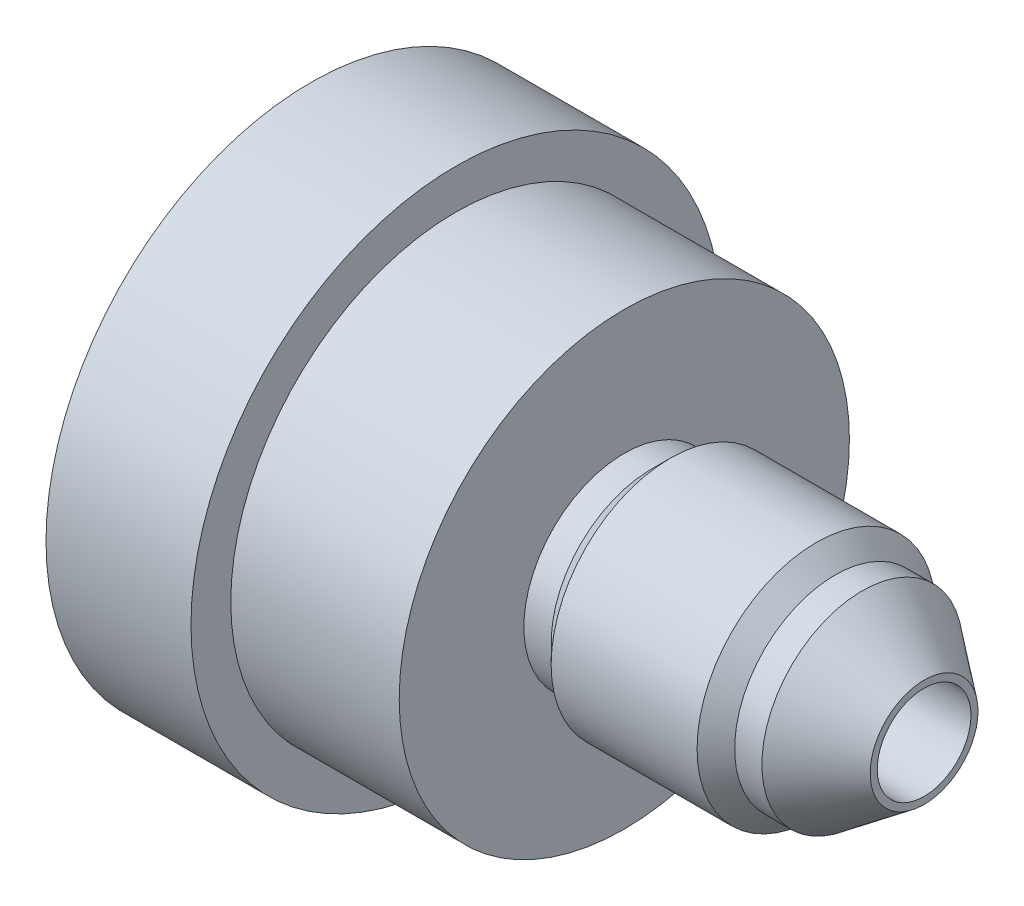
from build123d import *

# Parameters (mm, degrees)
CUT_SWEEP1_PITCH = 1.27


with BuildPart() as part:
    # Sketch1 → Revolve1 (revolve)
    with BuildSketch(Plane.XY, mode=Mode.PRIVATE) as revolve1_sk:
        Polygon((-14.2875, 12.3444), (-14.2875, 11.176), (-2.355243782, 2.1844), (14.2875, 2.1844), (14.2875, 2.51206), (14.2875, 5.55625), (10.247723424, 5.55625), (0.3175, 5.55625), (0.3175, 10.4902), (-7.5311, 10.4902), (-7.5311, 12.3444), align=None)
    revolve(revolve1_sk.sketch.rotate(Axis((-14.2875, 0, 0), (1, 0, 0)), 90), axis=Axis((-14.2875, 0, 0), (1, 0, 0)))

    # Cut-Sweep1: the profile of Sketch4 profile screwed along a right-hand helix of 11 turns, 8 arcs to a turn; built about Z, then put on its axis
    cut_sweep1_z = Axis((0, 0, 0), (0, 0, 1))
    cut_sweep1_corners = [(5.55655, 0, 0.000173205), (5.55655, 0, -1.111423205), (4.731360803, 0, -0.635), (4.731360803, 0, -0.47625)]
    with BuildLine(mode=Mode.PRIVATE) as cut_sweep1_profile:
        Line(cut_sweep1_corners[0], cut_sweep1_corners[1])
        Line(cut_sweep1_corners[1], cut_sweep1_corners[2])
        Line(cut_sweep1_corners[2], cut_sweep1_corners[3])
        Line(cut_sweep1_corners[3], cut_sweep1_corners[0])
    cut_sweep1_cap = Face(cut_sweep1_profile.wire())
    cut_sweep1_turn_angles = [0, 22.5, 45, 67.5, 90, 112.5, 135, 157.5, 180, 202.5, 225, 247.5, 270, 292.5, 315, 337.5, 360]
    cut_sweep1_turn_weights = [1, 0.9238795325112867, 1, 0.9238795325112867, 1, 0.9238795325112867, 1, 0.9238795325112867, 1, 0.9238795325112867, 1, 0.9238795325112867, 1, 0.9238795325112867, 1, 0.9238795325112867, 1]
    cut_sweep1_turn_rails = [Edge.make_bspline([Vector(p[0], p[1], 0).rotate(cut_sweep1_z, cut_sweep1_turn_angles[k]) / cut_sweep1_turn_weights[k] + Vector(0, 0, p[2] + CUT_SWEEP1_PITCH * cut_sweep1_turn_angles[k] / 360) for k in range(17)], [0, 0, 0, 1, 1, 2, 2, 3, 3, 4, 4, 5, 5, 6, 6, 7, 7, 8, 8, 8], 2, cut_sweep1_turn_weights) for p in cut_sweep1_corners]
    cut_sweep1_turn_sides = [Face.make_surface_from_curves(cut_sweep1_turn_rails[p[0]], cut_sweep1_turn_rails[p[1]]) for p in [(0, 1), (1, 2), (2, 3), (3, 0)]]
    cut_sweep1_turn = Solid(Shell([*cut_sweep1_turn_sides, cut_sweep1_cap, cut_sweep1_cap.rotate(cut_sweep1_z, 360).moved(Location((0, 0, CUT_SWEEP1_PITCH * 360 / 360)))]))
    cut_sweep1_each = [*[cut_sweep1_turn.moved(Location((0, 0, CUT_SWEEP1_PITCH * i))) for i in range(11)]]
    add(Plane(origin=(14.2875, 0, 0), x_dir=(0, 1, 0), z_dir=(-1, 0, 0)) * Compound([cut_sweep1_each[i] for i in range(0, 11, 2)]), mode=Mode.SUBTRACT)
    add(Plane(origin=(14.2875, 0, 0), x_dir=(0, 1, 0), z_dir=(-1, 0, 0)) * Compound([cut_sweep1_each[i] for i in range(1, 11, 2)]), mode=Mode.SUBTRACT)

    # Sketch5 → Cut-Revolve1 (revolve, cut)
    with BuildSketch(Plane.XY, mode=Mode.PRIVATE) as cut_revolve1_sk:
        Polygon((14.2875, 2.51206), (11.409802239, 4.680560803), (10.139802239, 4.680560803), (9.264113042, 5.55625), (14.2875, 5.55625), align=None)
        Polygon((0.3175, 5.55625), (0.3175, 4.680560803), (1.5875, 4.680560803), (2.463189197, 5.55625), align=None)
    revolve(cut_revolve1_sk.sketch.rotate(Axis((0, 0, 0), (-1, 0, 0)), 90), axis=Axis((0, 0, 0), (-1, 0, 0)), mode=Mode.SUBTRACT)

    # Sketch6 → Revolve2 (revolve)
    with BuildSketch(Plane.XY, mode=Mode.PRIVATE) as revolve2_sk:
        Polygon((2.463189197, 5.55625), (1.5875, 4.680560803), (10.139802239, 4.680560803), (9.264113042, 5.55625), align=None)
    revolve(revolve2_sk.sketch.rotate(Axis((0, 0, 0), (1, 0, 0)), 270), axis=Axis((0, 0, 0), (1, 0, 0)))


solid = part.part
